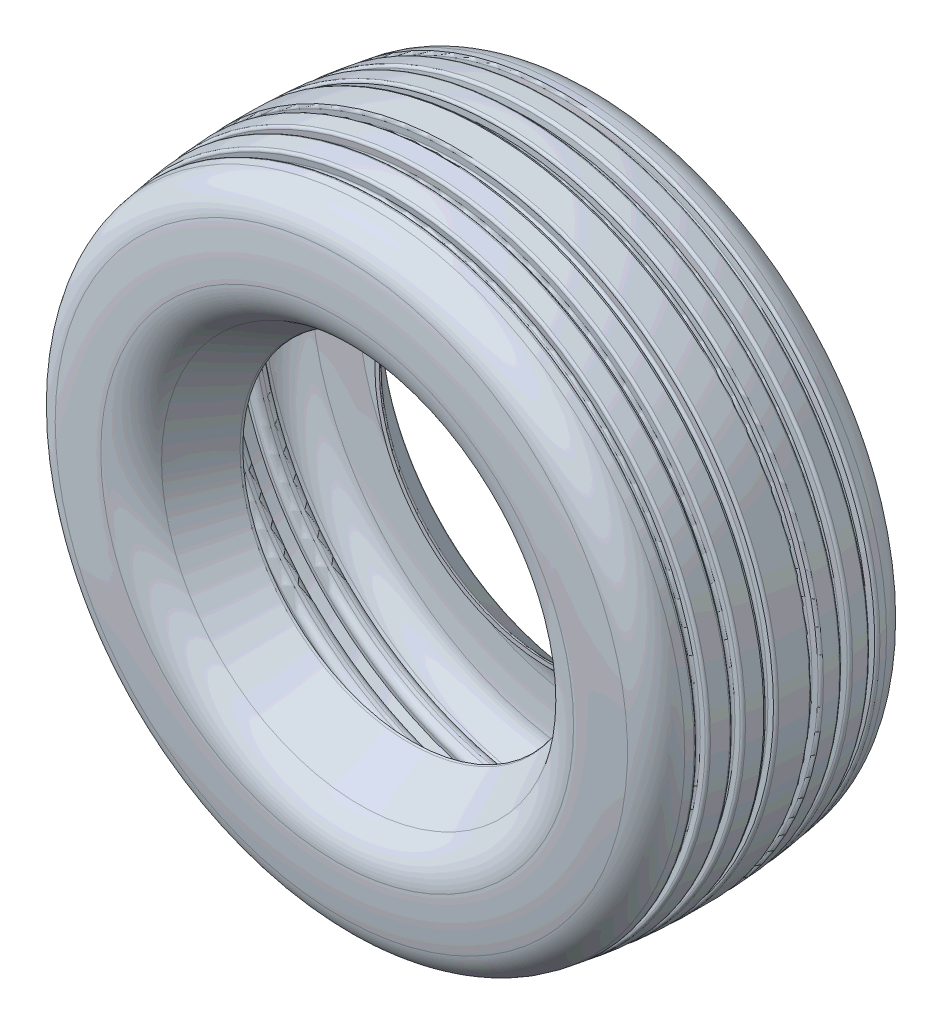
from build123d import *

# Parameters (mm, degrees)
CONG_1_R              = 6
CONG_1_OF_SYM_TRIE1_R = 6
CHANFREIN1_SIZE       = 100
CHANFREIN1_SIZE_2     = 145.223576727
CONG_4_R              = 100
CONG_6_R              = 80
CONG_7_R              = 10


with BuildPart() as part:
    # Esquisse1 → Révolution1 (revolve)
    with BuildSketch(Plane(origin=(0, 0, 0), x_dir=(0, 0, -1), z_dir=(1, 0, 0)), mode=Mode.PRIVATE) as r_volution1_sk:
        with BuildLine():
            Line((-280, 382.94), (280, 382.94))
            ThreePointArc((280, 382.94), (302.085813857, 541.47), (280, 700))
            ThreePointArc((280, 700), (0, 730), (-280, 700))
            ThreePointArc((-280, 700), (-302.085813857, 541.47), (-280, 382.94))
        make_face()
    revolve(r_volution1_sk.sketch.rotate(Axis((0, 0, 600), (0, 0, -1)), 90), axis=Axis((0, 0, 600), (0, 0, -1)))

    # Esquisse4 → Enlèvement de matière-Révolution1 (revolve, cut)
    with BuildSketch(Plane(origin=(0, 0, 0), x_dir=(0, 0, -1), z_dir=(1, 0, 0)), mode=Mode.PRIVATE) as enl_vement_de_mati_re_r_volution1_sk:
        with BuildLine():
            Line((-40, 704.38288657), (-40.771208226, 729.370988496))
            ThreePointArc((-40.771208226, 729.370988496), (-50.965528181, 729.016979297), (-61.156812339, 728.584302688))
            Line((-61.156812339, 728.584302688), (-60, 703.611081326))
            ThreePointArc((-60, 703.611081326), (-50.001489186, 704.035573635), (-40, 704.38288657))
        make_face()
        with BuildLine():
            Line((-110, 700.325765372), (-112.120822622, 725.235645167))
            ThreePointArc((-112.120822622, 725.235645167), (-122.317293643, 724.32773205), (-132.506426735, 723.340871202))
            Line((-132.506426735, 723.340871202), (-130, 698.466832024))
            ThreePointArc((-130, 698.466832024), (-120.003599564, 699.435025895), (-110, 700.325765372))
        make_face()
        with BuildLine():
            Line((-180, 692.445651024), (-183.470437018, 717.203600594))
            ThreePointArc((-183.470437018, 717.203600594), (-193.669124897, 715.733443414), (-203.856041131, 714.183819519))
            Line((-203.856041131, 714.183819519), (-200, 689.482990651))
            ThreePointArc((-200, 689.482990651), (-190.005774489, 691.003302618), (-180, 692.445651024))
        make_face()
    enl_vement_de_mati_re_r_volution1 = revolve(enl_vement_de_mati_re_r_volution1_sk.sketch.rotate(Axis((0, 0, 274.703656999), (0, 0, -1)), 90), axis=Axis((0, 0, 274.703656999), (0, 0, -1)), mode=Mode.SUBTRACT)

    # Congé1
    cong_1_edges = [part.edges().sort_by_distance(p)[0] for p in [
        (-703.611081326, 0, 60),
        (-704.38288657, 0, 40),
        (-729.370988496, 0, 40.771208226),
        (-728.584302688, 0, 61.156812339),
        (-698.466832024, 0, 130),
        (-700.325765372, 0, 110),
        (-725.235645167, 0, 112.120822622),
        (-723.340871202, 0, 132.506426735),
        (-689.482990651, 0, 200),
        (-692.445651024, 0, 180),
        (-717.203600594, 0, 183.470437018),
        (-714.183819519, 0, 203.856041131),
    ]]
    fillet(cong_1_edges, radius=CONG_1_R)

    # Symétrie1: Enlèvement de matière-Révolution1 across plane
    add(enl_vement_de_mati_re_r_volution1.mirror(Plane.XY), mode=Mode.SUBTRACT)

    # Congé1 of Symétrie1
    cong_1_of_sym_trie1_edges = [part.edges().sort_by_distance(p)[0] for p in [
        (-703.611081326, 0, -60),
        (-704.38288657, 0, -40),
        (-729.370988496, 0, -40.771208226),
        (-728.584302688, 0, -61.156812339),
        (-698.466832024, 0, -130),
        (-700.325765372, 0, -110),
        (-725.235645167, 0, -112.120822622),
        (-723.340871202, 0, -132.506426735),
        (-689.482990651, 0, -200),
        (-692.445651024, 0, -180),
        (-717.203600594, 0, -183.470437018),
        (-714.183819519, 0, -203.856041131),
    ]]
    fillet(cong_1_of_sym_trie1_edges, radius=CONG_1_OF_SYM_TRIE1_R)

    # Chanfrein1
    # the kernel refuses this chamfer: 145.223576727, 100 mm, written as the material it takes off along each edge
    with BuildSketch(Plane(origin=(0, 0, -280), x_dir=(1, 0, 0), z_dir=(0, 1, 0))) as chanfrein1_piece_1:
        with BuildLine():
            Line((503.801305248, 20.861305248), (382.94, -CHANFREIN1_SIZE))
            Line((382.94, -CHANFREIN1_SIZE), (382.94, 0))
            ThreePointArc((382.94, 0), (445.163454172, 14.034281143), (503.801305248, 20.861305248))
        make_face()
    revolve(axis=Axis((0, 0, -280), (0, 0, -1)), mode=Mode.SUBTRACT)
    with BuildSketch(Plane(origin=(0, 0, 280), x_dir=(1, 0, 0), z_dir=(0, 1, 0))) as chanfrein1_piece_2:
        with BuildLine():
            Line((382.94, CHANFREIN1_SIZE_2), (474.012948094, -18.149652462))
            ThreePointArc((474.012948094, -18.149652462), (429.958576334, -11.265225283), (382.94, 0))
            Line((382.94, 0), (382.94, CHANFREIN1_SIZE_2))
        make_face()
    revolve(axis=Axis((0, 0, 280), (0, 0, -1)), mode=Mode.SUBTRACT)

    # Congé4
    cong_4_edges = [part.edges().sort_by_distance(p)[0] for p in [
        (-474.012948094, 0, 298.149652462),
        (-503.801305248, 0, -300.861305248),
    ]]
    fillet(cong_4_edges, radius=CONG_4_R)

    # Congé6
    cong_6_edges = [part.edges().sort_by_distance(p)[0] for p in [
        (-700, 0, 280),
        (-700, 0, -280),
    ]]
    fillet(cong_6_edges, radius=CONG_6_R)

    # Congé7
    cong_7_edges = [part.edges().sort_by_distance(p)[0] for p in [
        (-382.94, 0, -180),
        (-382.94, 0, 134.776423273),
    ]]
    fillet(cong_7_edges, radius=CONG_7_R)

    # Coque1: read off the stored shape, not the designer's step
    # Coque1 outline → Coque1 (revolve, cut)
    with BuildSketch(Plane.XZ):
        with BuildLine():
            Line((392.94, 132.177430032), (382.94, 132.177430032))
            Line((382.94, 132.177430032), (382.94, -175.857864376))
            Line((382.94, -175.857864376), (392.94, -175.857864376))
            Line((392.94, -175.857864376), (482.782018867, -265.699883243))
            ThreePointArc((482.782018867, -265.699883243), (512.409463084, -285.3859746), (547.350059643, -292.055484013))
            ThreePointArc((547.350059643, -292.055484013), (595.886543191, -289.482359341), (644.027353451, -282.78358383))
            ThreePointArc((644.027353451, -282.78358383), (681.121670384, -263.231088093), (700.385837473, -225.986218586))
            ThreePointArc((700.385837473, -225.986218586), (701.573025022, -219.090265153), (702.723407701, -212.188076535))
            Line((702.723407701, -212.188076535), (693.8551206, -210.803650126))
            ThreePointArc((693.8551206, -210.803650126), (683.421381671, -204.458130898), (680.5032573, -192.600092592))
            ThreePointArc((680.5032573, -192.600092592), (681.1112463, -188.540434326), (681.706280441, -184.478857017))
            ThreePointArc((681.706280441, -184.478857017), (687.936786847, -173.976033004), (699.76204963, -170.927806893))
            Line((699.76204963, -170.927806893), (708.650844657, -172.173790661))
            ThreePointArc((708.650844657, -172.173790661), (710.591413165, -156.822632158), (712.350756907, -141.449649913))
            Line((712.350756907, -141.449649913), (703.42028247, -140.549772747))
            ThreePointArc((703.42028247, -140.549772747), (692.656755731, -134.78132283), (689.097790927, -123.099615256))
            ThreePointArc((689.097790927, -123.099615256), (689.477943433, -119.078121932), (689.845468818, -115.05545496))
            ThreePointArc((689.845468818, -115.05545496), (695.496419971, -104.229778381), (707.138697499, -100.5438733))
            Line((707.138697499, -100.5438733), (716.082039718, -101.305307825))
            ThreePointArc((716.082039718, -101.305307825), (717.177692715, -85.999345106), (718.094210045, -70.681612041))
            Line((718.094210045, -70.681612041), (709.128126435, -70.266284118))
            ThreePointArc((709.128126435, -70.266284118), (698.06823595, -65.088703142), (693.882384146, -53.616686449))
            ThreePointArc((693.882384146, -53.616686449), (694.043011371, -49.615873588), (694.191187523, -45.614580237))
            ThreePointArc((694.191187523, -45.614580237), (699.24869031, -34.499267022), (710.674703016, -30.189422945))
            Line((710.674703016, -30.189422945), (719.646129163, -30.466308227))
            ThreePointArc((719.646129163, -30.466308227), (720, 0), (719.646129163, 30.466308227))
            Line((719.646129163, 30.466308227), (710.674703016, 30.189422945))
            ThreePointArc((710.674703016, 30.189422945), (699.24869031, 34.499267022), (694.191187523, 45.614580237))
            ThreePointArc((694.191187523, 45.614580237), (694.043011371, 49.615873588), (693.882384146, 53.616686449))
            ThreePointArc((693.882384146, 53.616686449), (698.06823595, 65.088703142), (709.128126435, 70.266284118))
            Line((709.128126435, 70.266284118), (718.094210045, 70.681612041))
            ThreePointArc((718.094210045, 70.681612041), (717.177692715, 85.999345106), (716.082039718, 101.305307825))
            Line((716.082039718, 101.305307825), (707.138697499, 100.5438733))
            ThreePointArc((707.138697499, 100.5438733), (695.496419971, 104.229778381), (689.845468818, 115.05545496))
            ThreePointArc((689.845468818, 115.05545496), (689.477943433, 119.078121932), (689.097790927, 123.099615256))
            ThreePointArc((689.097790927, 123.099615256), (692.656755731, 134.78132283), (703.42028247, 140.549772747))
            Line((703.42028247, 140.549772747), (712.350756907, 141.449649913))
            ThreePointArc((712.350756907, 141.449649913), (710.591413165, 156.822632158), (708.650844657, 172.173790661))
            Line((708.650844657, 172.173790661), (699.76204963, 170.927806893))
            ThreePointArc((699.76204963, 170.927806893), (687.936786847, 173.976033004), (681.706280441, 184.478857017))
            ThreePointArc((681.706280441, 184.478857017), (681.1112463, 188.540434326), (680.5032573, 192.600092592))
            ThreePointArc((680.5032573, 192.600092592), (683.421381671, 204.458130898), (693.8551206, 210.803650126))
            Line((693.8551206, 210.803650126), (702.723407701, 212.188076535))
            ThreePointArc((702.723407701, 212.188076535), (701.573025022, 219.090265153), (700.385837473, 225.986218586))
            ThreePointArc((700.385837473, 225.986218586), (681.121670384, 263.231088093), (644.027353451, 282.78358383))
            ThreePointArc((644.027353451, 282.78358383), (589.087770175, 290.093338423), (533.69798128, 292.032825188))
            ThreePointArc((533.69798128, 292.032825188), (488.811851661, 279.330029578), (456.314402798, 245.863009007))
            Line((456.314402798, 245.863009007), (392.94, 132.177430032))
        make_face()
    revolve(axis=Axis((0, 0, 0), (0, 0, 1)), mode=Mode.SUBTRACT)


solid = part.part
